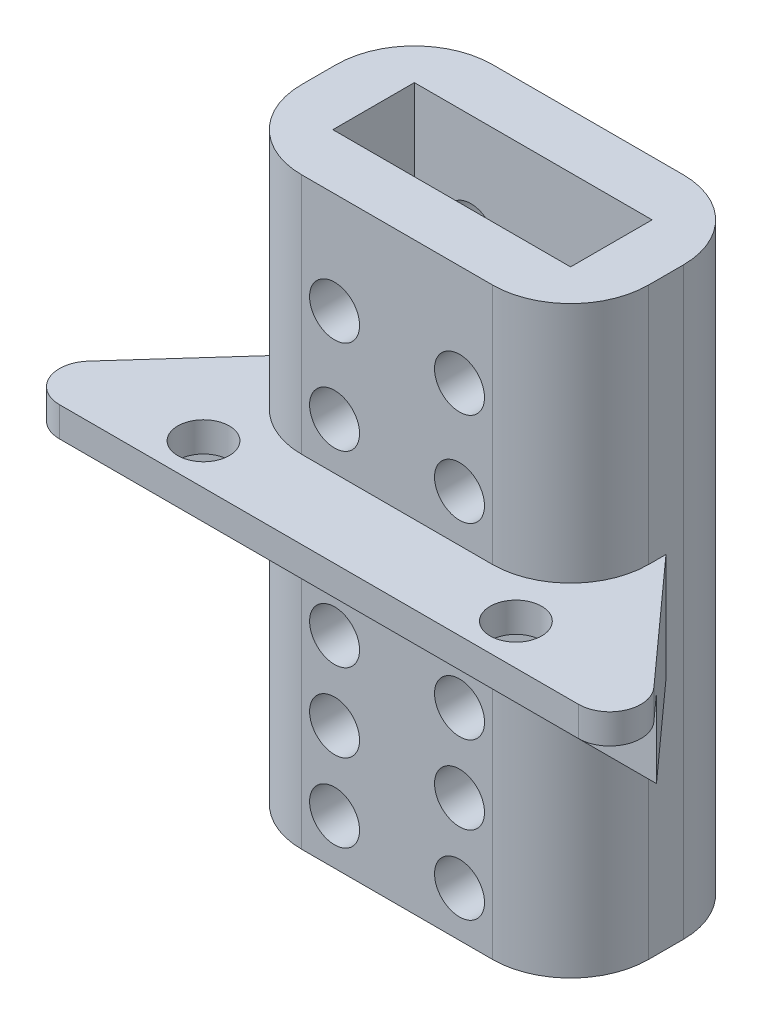
from build123d import *
from build123d.topology import SkipClean

# Parameters (mm, degrees)
SKETCH_1_W                     = 22.22
SKETCH_1_H                     = 12.22
SKETCH_1_W_2                   = 15.22
SKETCH_1_H_2                   = 5.22
EXTRUDE_1_DEPTH                = 25
EXTRUDE_START                  = -2
SKETCH_3_W                     = 15.22
SKETCH_3_H                     = 5.22
EXTRUDE_2_DEPTH                = 9
SKETCH_4_W                     = 54.706051552
SKETCH_4_H                     = 5.2
CUT_EXTRUDE_1_DEPTH            = 5
SKETCH_5_W                     = 55.616807128
SKETCH_5_H                     = 5.2
CUT_EXTRUDE_2_DEPTH            = 5
FILLET_1_R                     = 2
PATTERN_LINEAR_1_COUNT         = 2
PATTERN_LINEAR_1_PITCH         = 10
FILLET_1_OF_PATTERN_LINEAR_1_R = 2
SKETCH_7_R                     = 1.65
CUT_EXTRUDE_5_DEPTH            = 29
CUT_EXTRUDE_START              = 1
CUT_EXTRUDE_7_OUTLINE_R        = 1.65
CUT_EXTRUDE_7_DEPTH            = 9
SKETCH_9_W                     = 15.22
SKETCH_9_H                     = 5.22
EXTRUDE_3_DEPTH                = 15
CUT_EXTRUDE_8_DEPTH            = 18
FILLET_2_R                     = 5
SKETCH_12_R                    = 1.6
CUT_EXTRUDE_9_DEPTH            = 16
SKETCH_13_R                    = 1.65
EXTRUDE_4_DEPTH                = 0.5
CUT_EXTRUDE_START_2            = -2.6
CUT_EXTRUDE_10_DEPTH           = 2.6
SKETCH_15_W                    = 15.22
SKETCH_15_H                    = 5.22
CUT_EXTRUDE_11_DEPTH           = 25.977155973
SKETCH_16_W                    = 15.22
SKETCH_16_H                    = 5.22
EXTRUDE_5_DEPTH                = 15
SKETCH_17_R                    = 1.6
CUT_EXTRUDE_12_DEPTH           = 34.48125775


# Read off the part's stored shape, not the designer's step: 切除-拉伸7
with BuildPart() as part:
    # 草图1 → 凸台-拉伸1 (new body)
    with BuildSketch(Plane(origin=(0, 0, 0), x_dir=(1, 0, 0), z_dir=(0, 1, 0))):
        Rectangle(SKETCH_1_W, SKETCH_1_H)
        Rectangle(SKETCH_1_W_2, SKETCH_1_H_2, mode=Mode.SUBTRACT)
    extrude(amount=EXTRUDE_1_DEPTH)

    # 草图3 → 凸台-拉伸2 (add)
    with BuildSketch(Plane(origin=(0, 12.5, 0), x_dir=(1, 0, 0), z_dir=(0, 1, 0)).offset(EXTRUDE_START)):
        Polygon((11.11, 0), (21.11, -11.11), (-21.11, -11.11), (-11.11, 0), (-21.11, 11.11), (21.11, 11.11), align=None)
        Rectangle(SKETCH_3_W, SKETCH_3_H, mode=Mode.SUBTRACT)
    extrude_2 = extrude(amount=EXTRUDE_2_DEPTH)

    # 草图4 → 切除-拉伸1 (cut)
    with BuildSketch(Plane(origin=(0, 0, -11.11), x_dir=(-1, 0, 0), z_dir=(0, 0, -1))):
        with Locations((0, 15)):
            Rectangle(SKETCH_4_W, SKETCH_4_H)
    cut_extrude_1 = extrude(amount=-CUT_EXTRUDE_1_DEPTH, mode=Mode.SUBTRACT)

    # 草图5 → 切除-拉伸2 (cut)
    with BuildSketch(Plane.XY.offset(11.11)):
        with Locations((0, 15)):
            Rectangle(SKETCH_5_W, SKETCH_5_H)
    cut_extrude_2 = extrude(amount=-CUT_EXTRUDE_2_DEPTH, mode=Mode.SUBTRACT)

    # 圆角1
    fillet_1_edges = [part.edges().sort_by_distance(p)[0] for p in [
        (-21.11, 18.55, 11.11),
        (21.11, 18.55, 11.11),
        (21.11, 11.45, 11.11),
        (-21.11, 11.45, 11.11),
        (-21.11, 11.45, -11.11),
        (21.11, 11.45, -11.11),
        (21.11, 18.55, -11.11),
        (-21.11, 18.55, -11.11),
    ]]
    fillet(fillet_1_edges, radius=FILLET_1_R)

    # 阵列(线性)1: 凸台-拉伸2, 切除-拉伸1, 切除-拉伸2 ×2
    with Locations(*[(0, -i * PATTERN_LINEAR_1_PITCH, 0) for i in range(1, PATTERN_LINEAR_1_COUNT)]):
        add(extrude_2)
        add(cut_extrude_1, mode=Mode.SUBTRACT)
        add(cut_extrude_2, mode=Mode.SUBTRACT)

    # 圆角1 of 阵列(线性)1
    fillet_1_of_pattern_linear_1_edges = [part.edges().sort_by_distance(p)[0] for p in [
        (-21.11, 8.55, 11.11),
        (21.11, 8.55, 11.11),
        (21.11, 1.45, 11.11),
        (-21.11, 1.45, 11.11),
        (-21.11, 1.45, -11.11),
        (21.11, 1.45, -11.11),
        (21.11, 8.55, -11.11),
        (-21.11, 8.55, -11.11),
    ]]
    fillet(fillet_1_of_pattern_linear_1_edges, radius=FILLET_1_OF_PATTERN_LINEAR_1_R)

    # 草图7 → 切除-拉伸5 (cut)
    with BuildSketch(Plane(origin=(0, 19.5, 0), x_dir=(1, 0, 0), z_dir=(0, 1, 0))):
        with Locations(Location((-10, 8.5, 0), (0, 0, 270))):
            Circle(SKETCH_7_R)
        with Locations(Location((10, 8.5, 0), (0, 0, 270))):
            Circle(SKETCH_7_R)
        with Locations(Location((10, -8.5, 0), (0, 0, 270))):
            Circle(SKETCH_7_R)
        with Locations(Location((-10, -8.5, 0), (0, 0, 270))):
            Circle(SKETCH_7_R)
    extrude(amount=-CUT_EXTRUDE_5_DEPTH, mode=Mode.SUBTRACT)

    # 切除-拉伸7 outline → 切除-拉伸7 (cut)
    # profile 1 of 2: a face of its own
    with BuildSketch(Plane(origin=(0, 9.5, 0), x_dir=(1, 0, 0), z_dir=(0, 1, 0)).offset(CUT_EXTRUDE_START)):
        with BuildLine():
            Line((-18.105496504, 7.771996616), (-11.11, 0))
            Line((-11.11, 0), (-11.11, 6.11))
            Line((-11.11, 6.11), (11.11, 6.11))
            Line((11.11, 6.11), (11.11, 0))
            Line((11.11, 0), (18.105496504, 7.771996616))
            ThreePointArc((18.105496504, 7.771996616), (18.4459951, 9.923631744), (16.618974744, 11.11))
            Line((16.618974744, 11.11), (-16.618974744, 11.11))
            ThreePointArc((-16.618974744, 11.11), (-18.4459951, 9.923631744), (-18.105496504, 7.771996616))
        make_face()
        with Locations((-10, 8.5)):
            Circle(CUT_EXTRUDE_7_OUTLINE_R, mode=Mode.SUBTRACT)
        with Locations((10, 8.5)):
            Circle(CUT_EXTRUDE_7_OUTLINE_R, mode=Mode.SUBTRACT)
    # profile 2 of 2: a face of its own
    with BuildSketch(Plane(origin=(0, 9.5, 0), x_dir=(1, 0, 0), z_dir=(0, 1, 0)).offset(CUT_EXTRUDE_START)):
        with BuildLine():
            Line((-11.11, -6.11), (-11.11, 0))
            Line((-11.11, 0), (-18.105496504, -7.771996616))
            ThreePointArc((-18.105496504, -7.771996616), (-18.4459951, -9.923631744), (-16.618974744, -11.11))
            Line((-16.618974744, -11.11), (16.618974744, -11.11))
            ThreePointArc((16.618974744, -11.11), (18.4459951, -9.923631744), (18.105496504, -7.771996616))
            Line((18.105496504, -7.771996616), (11.11, 0))
            Line((11.11, 0), (11.11, -6.11))
            Line((11.11, -6.11), (-11.11, -6.11))
        make_face()
        with Locations((10, -8.5)):
            Circle(CUT_EXTRUDE_7_OUTLINE_R, mode=Mode.SUBTRACT)
        with Locations((-10, -8.5)):
            Circle(CUT_EXTRUDE_7_OUTLINE_R, mode=Mode.SUBTRACT)
    extrude(amount=CUT_EXTRUDE_7_DEPTH, mode=Mode.SUBTRACT)

    # 草图9 → 凸台-拉伸3 (add)
    with BuildSketch(Plane.XZ):
        Rectangle(SKETCH_9_W, SKETCH_9_H)
    extrude(amount=-EXTRUDE_3_DEPTH)

    # 草图11 → 切除-拉伸8 (cut)
    with BuildSketch(Plane(origin=(0, 9.5, 0), x_dir=(1, 0, 0), z_dir=(0, 1, 0))):
        with BuildLine():
            Line((11.11, 0), (18.105496504, 7.771996616))
            ThreePointArc((18.105496504, 7.771996616), (18.4459951, 9.923631744), (16.618974744, 11.11))
            Line((16.618974744, 11.11), (-16.618974744, 11.11))
            ThreePointArc((-16.618974744, 11.11), (-18.4459951, 9.923631744), (-18.105496504, 7.771996616))
            Line((-18.105496504, 7.771996616), (-11.11, 0))
            Line((-11.11, 0), (-11.11, 6.11))
            Line((-11.11, 6.11), (11.11, 6.11))
            Line((11.11, 6.11), (11.11, 0))
        make_face()
    extrude(amount=-CUT_EXTRUDE_8_DEPTH, mode=Mode.SUBTRACT)

    # 圆角2
    fillet_2_edges = [part.edges().sort_by_distance(p)[0] for p in [
        (11.11, 12.5, -6.11),
        (11.11, 17.25, 6.11),
        (-11.11, 17.25, 6.11),
        (-11.11, 12.5, -6.11),
    ]]
    fillet(fillet_2_edges, radius=FILLET_2_R)

    # 草图12 → 切除-拉伸9 (cut)
    with BuildSketch(Plane(origin=(0, 0, -6.11), x_dir=(-1, 0, 0), z_dir=(0, 0, -1))):
        with Locations((-4, 18.5)):
            Circle(SKETCH_12_R)
        with Locations((4, 18.5)):
            Circle(SKETCH_12_R)
        with Locations((-4, 12.5)):
            Circle(SKETCH_12_R)
        with Locations((4, 12.5)):
            Circle(SKETCH_12_R)
    extrude(amount=-CUT_EXTRUDE_9_DEPTH, mode=Mode.SUBTRACT)

    # 草图13 → 凸台-拉伸4 (add)
    with SkipClean():  # the faces are left unmerged after this step: merging them gives an invalid solid
        with BuildSketch(Plane.XZ.offset(-0.5)):
            with BuildLine():
                Line((11.11, 0), (18.105496504, 7.771996616))
                ThreePointArc((18.105496504, 7.771996616), (18.4459951, 9.923631744), (16.618974744, 11.11))
                Line((16.618974744, 11.11), (-16.618974744, 11.11))
                ThreePointArc((-16.618974744, 11.11), (-18.4459951, 9.923631744), (-18.105496504, 7.771996616))
                Line((-18.105496504, 7.771996616), (-11.11, 0))
                Line((-11.11, 0), (-11.11, 6.11))
                Line((-11.11, 6.11), (11.11, 6.11))
                Line((11.11, 6.11), (11.11, 0))
            make_face()
            with Locations(Location((-10, 8.5, 0), (0, 0, 270))):
                Circle(SKETCH_13_R, mode=Mode.SUBTRACT)
            with Locations(Location((10, 8.5, 0), (0, 0, 270))):
                Circle(SKETCH_13_R, mode=Mode.SUBTRACT)
        extrude(amount=EXTRUDE_4_DEPTH)

    # 草图14 → 切除-拉伸10 (cut)
    with BuildSketch(Plane.XZ.offset(CUT_EXTRUDE_START_2)):
        with BuildLine():
            Line((-6.11, -6.11), (6.11, -6.11))
            ThreePointArc((6.11, -6.11), (9.645533906, -4.645533906), (11.11, -1.11))
            Line((11.11, -1.11), (11.11, 0))
            Line((11.11, 0), (18.105496504, 7.771996616))
            ThreePointArc((18.105496504, 7.771996616), (18.4459951, 9.923631744), (16.618974744, 11.11))
            Line((16.618974744, 11.11), (-16.618974744, 11.11))
            ThreePointArc((-16.618974744, 11.11), (-18.4459951, 9.923631744), (-18.105496504, 7.771996616))
            Line((-18.105496504, 7.771996616), (-11.11, 0))
            Line((-11.11, 0), (-11.11, -1.11))
            ThreePointArc((-11.11, -1.11), (-9.645533906, -4.645533906), (-6.11, -6.11))
        make_face()
    extrude(amount=CUT_EXTRUDE_10_DEPTH, mode=Mode.SUBTRACT)

    # 草图15 → 切除-拉伸11 (cut, through all)
    with BuildSketch(Plane(origin=(0, 15, 0), x_dir=(1, 0, 0), z_dir=(0, 1, 0))):
        Rectangle(SKETCH_15_W, SKETCH_15_H)
    extrude(amount=-CUT_EXTRUDE_11_DEPTH, mode=Mode.SUBTRACT)

    # 草图16 → 凸台-拉伸5 (add)
    with BuildSketch(Plane.XZ.offset(-2.6)):
        with BuildLine():
            Line((11.11, -1.11), (11.11, 1.11))
            ThreePointArc((11.11, 1.11), (9.645533906, 4.645533906), (6.11, 6.11))
            Line((6.11, 6.11), (-6.11, 6.11))
            ThreePointArc((-6.11, 6.11), (-9.645533906, 4.645533906), (-11.11, 1.11))
            Line((-11.11, 1.11), (-11.11, -1.11))
            ThreePointArc((-11.11, -1.11), (-9.645533906, -4.645533906), (-6.11, -6.11))
            Line((-6.11, -6.11), (6.11, -6.11))
            ThreePointArc((6.11, -6.11), (9.645533906, -4.645533906), (11.11, -1.11))
        make_face()
        Rectangle(SKETCH_16_W, SKETCH_16_H, mode=Mode.SUBTRACT)
    extrude(amount=EXTRUDE_5_DEPTH)

    # 草图17 → 切除-拉伸12 (cut, through all)
    with BuildSketch(Plane.XY.offset(6.11)):
        with Locations(Location((-4, 12.5, 0), (0, 0, 180))):
            Circle(SKETCH_17_R)
        with Locations(Location((4, 12.5, 0), (0, 0, 180))):
            Circle(SKETCH_17_R)
        with Locations((-4, -9.5)):
            Circle(SKETCH_17_R)
        with Locations((4, -9.5)):
            Circle(SKETCH_17_R)
        with Locations((-4, -4.5)):
            Circle(SKETCH_17_R)
        with Locations((4, -4.5)):
            Circle(SKETCH_17_R)
        with Locations((-4, 0.5)):
            Circle(SKETCH_17_R)
        with Locations((4, 0.5)):
            Circle(SKETCH_17_R)
    extrude(amount=-CUT_EXTRUDE_12_DEPTH, mode=Mode.SUBTRACT)


solid = part.part
